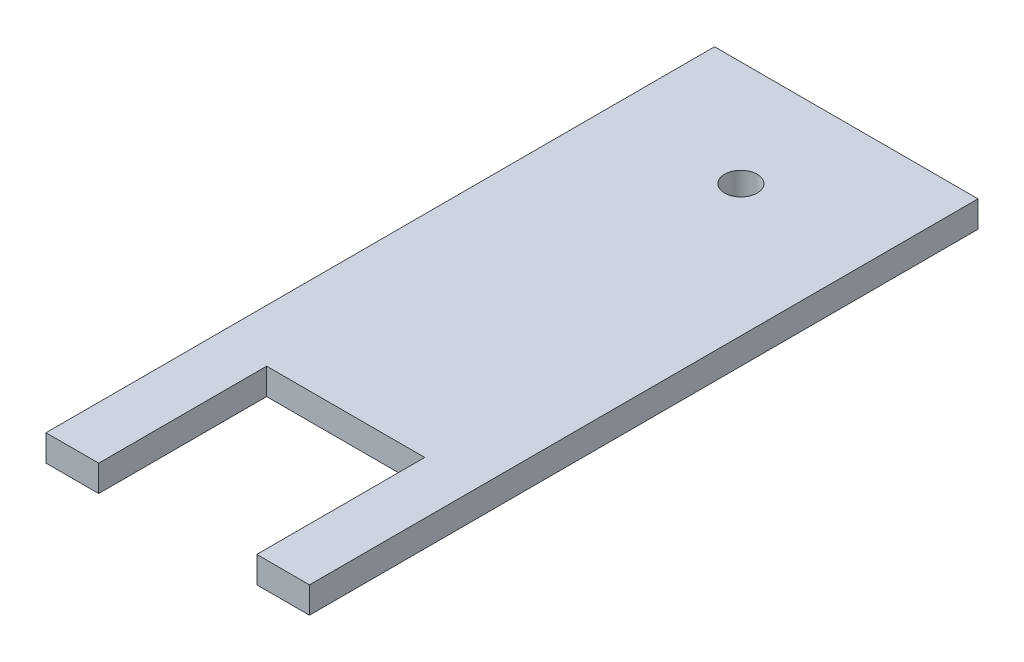
from build123d import *

# Parameters (mm, degrees)
SKETCH1_R           = 7.874
BOSS_EXTRUDE1_DEPTH = 12.7


with BuildPart() as part:
    # Sketch1 → Boss-Extrude1 (new body)
    with BuildSketch(Plane(origin=(0, 0, 0), x_dir=(1, 0, 0), z_dir=(0, 1, 0))):
        Polygon((0, 241.3), (0, -80.9625), (25.4, -80.9625), (25.4, 0), (101.6, 0), (101.6, -80.9625), (127, -80.9625), (127, 241.3), align=None)
        with Locations((63.5, 190.5)):
            Circle(SKETCH1_R, mode=Mode.SUBTRACT)
    extrude(amount=BOSS_EXTRUDE1_DEPTH)


solid = part.part
